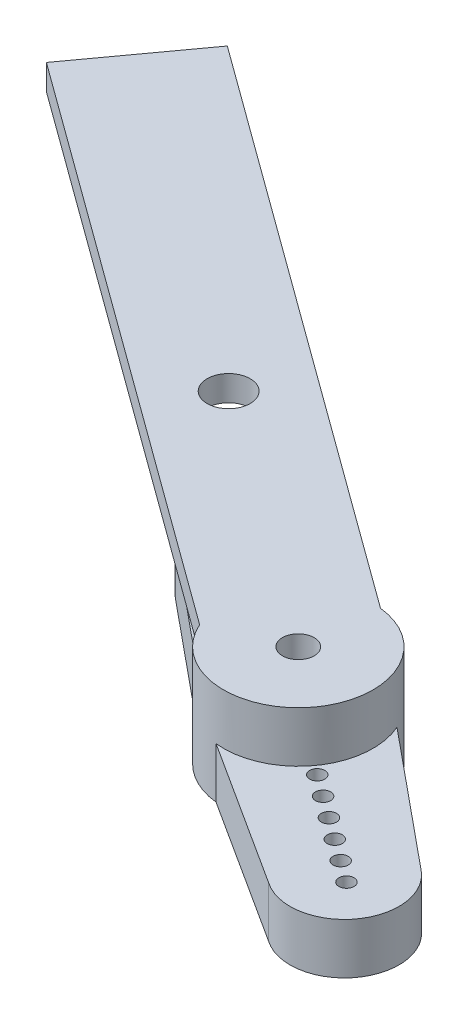
from build123d import *

# Parameters (mm, degrees)
EXTRUDE_START       = -2
EXTRUDE_1_DEPTH     = 2
SKETCH_2_R          = 0.6
SKETCH_2_R_2        = 1.25
EXTRUDE_2_DEPTH     = 2
SKETCH_3_R          = 5.9
SKETCH_3_R_2        = 1.25
EXTRUDE_3_DEPTH     = 4
EXTRUDE_4_DEPTH     = 2
SKETCH_5_R          = 1.7
CUT_EXTRUDE_1_DEPTH = 2


# Read off the part's stored shape, not the designer's step: 填料-伸長1
with BuildPart() as part:
    # 填料-伸長1 outline → 填料-伸長1 (new body)
    with BuildSketch(Plane(origin=(0, 18.156954032, 0), x_dir=(1, 0, 0), z_dir=(0, 1, 0)).offset(EXTRUDE_START)):
        with BuildLine():
            Line((-71.976510321, -204.833021781), (-61.351692907, -213.569524655))
            ThreePointArc((-61.351692907, -213.569524655), (-59.430720516, -215.948258819), (-56.577073779, -217.046080048))
            Line((-56.577073779, -217.046080048), (-45.000342303, -224.475246616))
            ThreePointArc((-45.000342303, -224.475246616), (-39.062154339, -223.48095501), (-39.939141491, -217.524312867))
            Line((-39.939141491, -217.524312867), (-50.563958905, -208.787809993))
            ThreePointArc((-50.563958905, -208.787809993), (-52.484931296, -206.409075829), (-55.338578032, -205.3112546))
            Line((-55.338578032, -205.3112546), (-66.915309509, -197.882088033))
            ThreePointArc((-66.915309509, -197.882088033), (-72.853497472, -198.876379638), (-71.976510321, -204.833021781))
        make_face()
        with BuildLine():
            ThreePointArc((-55.939819286, -215.078625755), (-58.253468106, -214.331448143), (-59.674933886, -212.358967399))
            Line((-59.674933886, -212.358967399), (-70.741141251, -203.259521386))
            ThreePointArc((-70.741141251, -203.259521386), (-71.236686796, -200.053632048), (-68.033499603, -199.540910248))
            Line((-68.033499603, -199.540910248), (-55.975832526, -207.278708893))
            ThreePointArc((-55.975832526, -207.278708893), (-53.662183706, -208.025886506), (-52.240717926, -209.998367249))
            Line((-52.240717926, -209.998367249), (-41.17451056, -219.097813262))
            ThreePointArc((-41.17451056, -219.097813262), (-40.678965016, -222.303702601), (-43.882152209, -222.8164244))
            Line((-43.882152209, -222.8164244), (-55.939819286, -215.078625755))
        make_face(mode=Mode.SUBTRACT)
    extrude(amount=EXTRUDE_1_DEPTH)

    # 草圖2 → 填料-伸長2 (add)
    with BuildSketch(Plane(origin=(0, 18.156954032, 0), x_dir=(1, 0, 0), z_dir=(0, 1, 0))):
        with BuildLine():
            Line((-56.577073779, -217.046080048), (-45.000342303, -224.475246616))
            ThreePointArc((-45.000342303, -224.475246616), (-39.06215434, -223.480955011), (-39.939141491, -217.524312867))
            Line((-39.939141491, -217.524312867), (-50.563958905, -208.787809993))
            ThreePointArc((-50.563958905, -208.787809993), (-52.484931296, -206.409075829), (-55.338578032, -205.3112546))
            Line((-55.338578032, -205.3112546), (-66.915309509, -197.882088033))
            ThreePointArc((-66.915309509, -197.882088033), (-72.853497472, -198.876379638), (-71.976510321, -204.833021781))
            Line((-71.976510321, -204.833021781), (-61.351692907, -213.569524655))
            ThreePointArc((-61.351692907, -213.569524655), (-59.430720516, -215.948258819), (-56.577073779, -217.046080048))
        make_face()
        with Locations(Location((-69.943238255, -200.995433976, 0), (0, 0, 180))):
            Circle(SKETCH_2_R, mode=Mode.SUBTRACT)
        with Locations(Location((-68.245587045, -202.231549007, 0), (0, 0, 180))):
            Circle(SKETCH_2_R, mode=Mode.SUBTRACT)
        with Locations(Location((-66.547935835, -203.467664037, 0), (0, 0, 180))):
            Circle(SKETCH_2_R, mode=Mode.SUBTRACT)
        with Locations(Location((-64.850284625, -204.703779068, 0), (0, 0, 180))):
            Circle(SKETCH_2_R, mode=Mode.SUBTRACT)
        with Locations(Location((-63.152633415, -205.939894099, 0), (0, 0, 180))):
            Circle(SKETCH_2_R, mode=Mode.SUBTRACT)
        with Locations(Location((-61.454982205, -207.176009129, 0), (0, 0, 180))):
            Circle(SKETCH_2_R, mode=Mode.SUBTRACT)
        with Locations(Location((-55.957825906, -211.178667324, 0), (0, 0, 180))):
            Circle(SKETCH_2_R_2, mode=Mode.SUBTRACT)
        with Locations(Location((-50.460669607, -215.181325519, 0), (0, 0, 180))):
            Circle(SKETCH_2_R, mode=Mode.SUBTRACT)
        with Locations(Location((-48.763018397, -216.41744055, 0), (0, 0, 180))):
            Circle(SKETCH_2_R, mode=Mode.SUBTRACT)
        with Locations(Location((-47.065367187, -217.65355558, 0), (0, 0, 180))):
            Circle(SKETCH_2_R, mode=Mode.SUBTRACT)
        with Locations(Location((-45.367715977, -218.889670611, 0), (0, 0, 180))):
            Circle(SKETCH_2_R, mode=Mode.SUBTRACT)
        with Locations(Location((-43.670064767, -220.125785642, 0), (0, 0, 180))):
            Circle(SKETCH_2_R, mode=Mode.SUBTRACT)
        with Locations(Location((-41.972413557, -221.361900672, 0), (0, 0, 180))):
            Circle(SKETCH_2_R, mode=Mode.SUBTRACT)
    extrude(amount=EXTRUDE_2_DEPTH)

    # 草圖3 → 填料-伸長3 (add)
    with BuildSketch(Plane(origin=(0, 20.156954032, 0), x_dir=(1, 0, 0), z_dir=(0, 1, 0))):
        with Locations(Location((-55.957825906, -211.178667324, 0), (0, 0, 180))):
            Circle(SKETCH_3_R)
        with Locations(Location((-55.957825906, -211.178667324, 0), (0, 0, 180))):
            Circle(SKETCH_3_R_2, mode=Mode.SUBTRACT)
    extrude(amount=EXTRUDE_3_DEPTH)

    # 草圖4 → 填料-伸長4 (add)
    with BuildSketch(Plane(origin=(0, 24.156954032, 0), x_dir=(1, 0, 0), z_dir=(0, 1, 0))):
        Polygon((-61.351692907, -213.569524655), (-55.338578032, -205.3112546), (-99.800871628, -172.93681332), (-105.813986502, -181.195083375), align=None)
    extrude(amount=-EXTRUDE_4_DEPTH)

    # 草圖5 → 除料-伸長1 (cut)
    with BuildSketch(Plane.XZ.offset(-22.156954032)):
        with Locations((-76.167959358, 196.463012197)):
            Circle(SKETCH_5_R)
    extrude(amount=-CUT_EXTRUDE_1_DEPTH, mode=Mode.SUBTRACT)


solid = part.part
